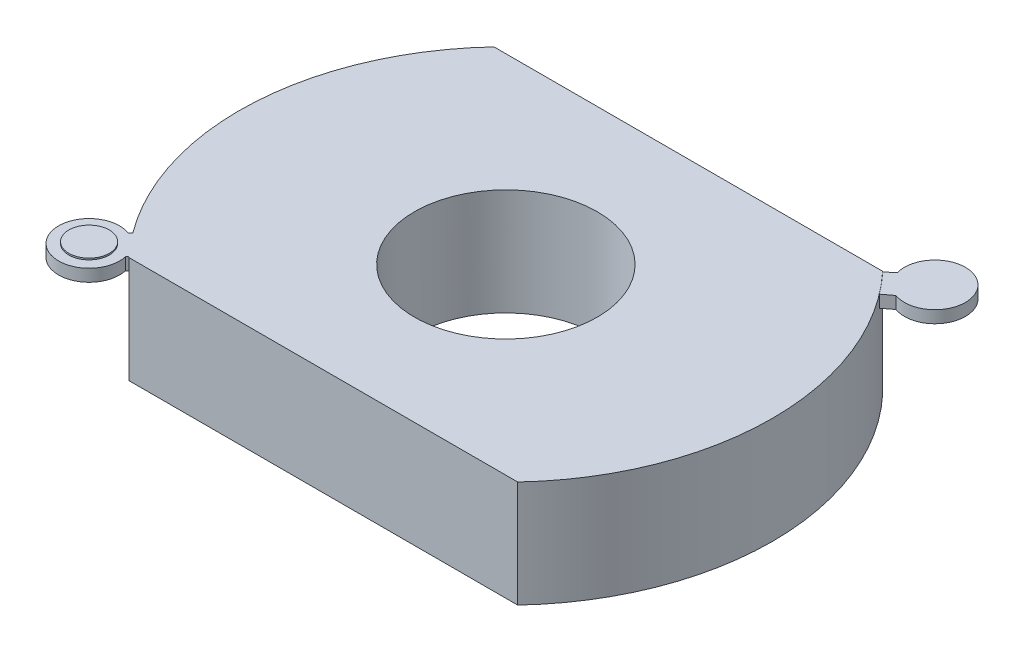
from build123d import *

# Parameters (mm, degrees)
SKETCH1_R                = 1750
BOSS_EXTRUDE1_DEPTH      = 700
CUT_EXTRUDE10_DEPTH      = 2572.964229922
CUT_EXTRUDE10_DEPTH_BACK = 2572.964229922
SKETCH9_W                = 5273.235769222
SKETCH9_H                = 4165.824449254
SKETCH9_W_2              = 4212.623718326
SKETCH9_H_2              = 2396.11984
CUT_EXTRUDE3_DEPTH       = 2234.348958831
CUT_EXTRUDE3_DEPTH_BACK  = 2234.348958831
SKETCH3_R                = 600
SHELL1_T                 = -1.5
BOSS_EXTRUDE2_START      = -80
BOSS_EXTRUDE2_DEPTH      = 80
BOSS_EXTRUDE3_DEPTH      = 80
BOSS_EXTRUDE4_DEPTH      = 50
SKETCH14_R               = 132.8125
BOSS_EXTRUDE5_DEPTH      = 10


with BuildPart() as part:
    # Sketch1 → Boss-Extrude1 (new body)
    with BuildSketch(Plane(origin=(0, 0, 0), x_dir=(1, 0, 0), z_dir=(0, 1, 0))):
        Circle(SKETCH1_R)
    extrude(amount=BOSS_EXTRUDE1_DEPTH)

    # Sketch9 → Cut-Extrude10 (cut, two sides: drawn at the far end of the back side and taken through both)
    with BuildSketch(Plane.XZ.offset(-CUT_EXTRUDE10_DEPTH_BACK)):
        Rectangle(SKETCH9_W, SKETCH9_H)
        Rectangle(SKETCH9_W_2, SKETCH9_H_2, mode=Mode.SUBTRACT)
    extrude(amount=CUT_EXTRUDE10_DEPTH + CUT_EXTRUDE10_DEPTH_BACK, mode=Mode.SUBTRACT)

    # Sketch3 → Cut-Extrude3 (cut, two sides: drawn at the far end of the back side and taken through both)
    with BuildSketch(Plane.XZ.offset(-CUT_EXTRUDE3_DEPTH_BACK)):
        Circle(SKETCH3_R)
    extrude(amount=CUT_EXTRUDE3_DEPTH + CUT_EXTRUDE3_DEPTH_BACK, mode=Mode.SUBTRACT)

    # Shell1
    shell1_openings = [part.faces().sort_by_distance(p)[0] for p in [
        (1707.583740986, 0, 0),
    ]]
    offset(amount=SHELL1_T, openings=shell1_openings, kind=Kind.INTERSECTION)

    # Sketch12 → Boss-Extrude2 (add)
    with BuildSketch(Plane(origin=(0, 700, 0), x_dir=(1, 0, 0), z_dir=(0, 1, 0)).offset(BOSS_EXTRUDE2_START)):
        with BuildLine():
            Line((-1292.618817131, -1204.490773147), (-1280.311431974, -1193.022479736))
            ThreePointArc((-1280.311431974, -1193.022479736), (-1343.294503774, -1121.632683248), (-1402.30213864, -1046.923450863))
            Line((-1402.30213864, -1046.923450863), (-1420.078110783, -1060.194543864))
            ThreePointArc((-1420.078110783, -1060.194543864), (-1637.634666887, -1380.807506947), (-1292.618817131, -1204.490773147))
        make_face()
    extrude(amount=BOSS_EXTRUDE2_DEPTH)

    # Sketch13 → Boss-Extrude4 (add)
    with BuildSketch(Plane(origin=(0, 698.5, 0), x_dir=(-1, 0, 0), z_dir=(0, -1, 0))):
        Polygon((838.224823525, -698.27995814), (994.506973536, -698.27995814), (1038.224823525, -698.27995814), (1038.224823525, -498.27995814), (838.224823525, -498.27995814), align=None)
        with BuildLine():
            ThreePointArc((965.724823525, -598.27995814), (961.964779353, -612.16032187), (951.712860088, -622.244992455))
            ThreePointArc((951.712860088, -622.244992455), (914.484867696, -584.399594411), (965.724823525, -598.27995814))
        make_face(mode=Mode.SUBTRACT)
    extrude(amount=BOSS_EXTRUDE4_DEPTH)

    # Sketch14 → Boss-Extrude5 (add)
    with BuildSketch(Plane(origin=(0, 700, 0), x_dir=(1, 0, 0), z_dir=(0, 1, 0))):
        with Locations((-1487.738800103, -1248.401959022)):
            Circle(SKETCH14_R)
    extrude(amount=BOSS_EXTRUDE5_DEPTH)


with BuildPart() as body_2:
    # Sketch12<6> → Boss-Extrude3 (new body)
    with BuildSketch(Plane(origin=(0, 700, 0), x_dir=(1, 0, 0), z_dir=(0, 1, 0))):
        with BuildLine():
            Line((1331.345960398, 1240.570459892), (1280.449619781, 1193.151226906))
            ThreePointArc((1280.449619781, 1193.151226906), (1339.360459475, 1126.542334417), (1394.743394808, 1056.972498526))
            Line((1394.743394808, 1056.972498526), (1456.886660309, 1104.066267063))
            ThreePointArc((1456.886660309, 1104.066267063), (1671.756740197, 1427.659779472), (1331.345960398, 1240.570459892))
        make_face()
    extrude(amount=-BOSS_EXTRUDE3_DEPTH)


solid = Compound([part.part, body_2.part])
